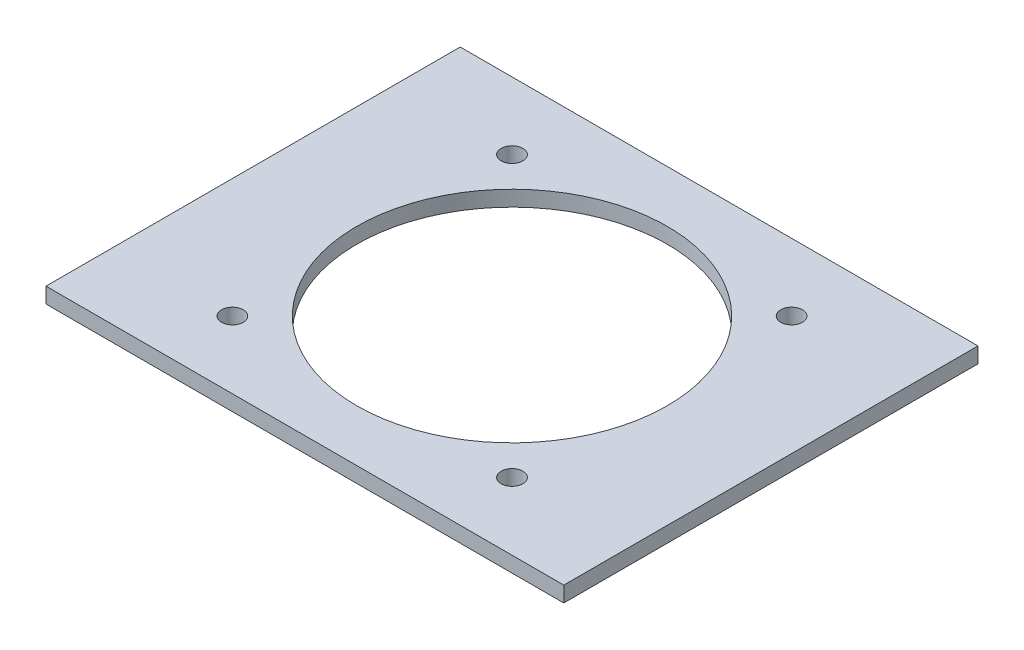
from build123d import *

# Parameters (mm, degrees)
SKETCH_1_W               = 100
SKETCH_1_H               = 80
SKETCH_1_R               = 30
EXTRUDE_1_DEPTH          = 3
SKETCH_2_R               = 2.1
CUT_EXTRUDE_1_DEPTH      = 10
PATTERN_CIRCULAR_1_COUNT = 4


with BuildPart() as part:
    # 草图1 → 凸台-拉伸1 (new body)
    with BuildSketch(Plane(origin=(0, 0, 0), x_dir=(1, 0, 0), z_dir=(0, 1, 0))):
        Rectangle(SKETCH_1_W, SKETCH_1_H)
        Circle(SKETCH_1_R, mode=Mode.SUBTRACT)
    extrude(amount=EXTRUDE_1_DEPTH)

    # 草图2 → 切除-拉伸1 (cut)
    with BuildSketch(Plane(origin=(0, 3, 0), x_dir=(1, 0, 0), z_dir=(0, 1, 0))):
        with Locations((27, 27)):
            Circle(SKETCH_2_R)
    cut_extrude_1 = extrude(amount=-CUT_EXTRUDE_1_DEPTH, mode=Mode.SUBTRACT)

    # 阵列(圆周)1: 切除-拉伸1 ×4 about axis
    pattern_circular_1_axis = Axis((0, 3, 0), (0, -1, 0))
    for i in range(1, PATTERN_CIRCULAR_1_COUNT):
        add(cut_extrude_1.rotate(pattern_circular_1_axis, i * 360 / PATTERN_CIRCULAR_1_COUNT), mode=Mode.SUBTRACT)


solid = part.part
